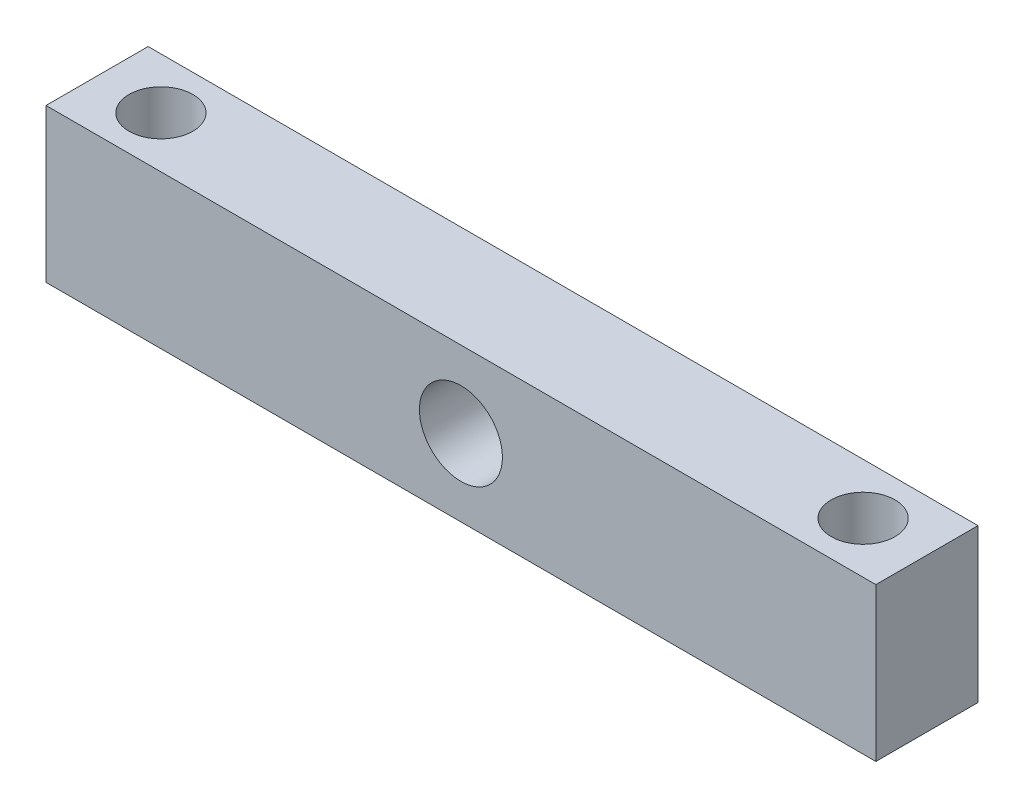
from build123d import *

# Parameters (mm, degrees)
SKETCH2_W           = 65
SKETCH2_H           = 8
SKETCH2_R           = 2.5
BOSS_EXTRUDE1_DEPTH = 12
SKETCH3_R           = 3.25
CUT_EXTRUDE1_DEPTH  = 36.556293395


with BuildPart() as part:
    # Sketch2 → Boss-Extrude1 (new body)
    with BuildSketch(Plane(origin=(0, 0, 0), x_dir=(1, 0, 0), z_dir=(0, 1, 0))):
        Rectangle(SKETCH2_W, SKETCH2_H)
        with Locations((-27.5, 0)):
            Circle(SKETCH2_R, mode=Mode.SUBTRACT)
        with Locations((27.5, 0)):
            Circle(SKETCH2_R, mode=Mode.SUBTRACT)
    extrude(amount=BOSS_EXTRUDE1_DEPTH)

    # Sketch3 → Cut-Extrude1 (cut, through all)
    with BuildSketch(Plane.XY.offset(4)):
        with Locations((0, 6)):
            Circle(SKETCH3_R)
    extrude(amount=-CUT_EXTRUDE1_DEPTH, mode=Mode.SUBTRACT)


solid = part.part
